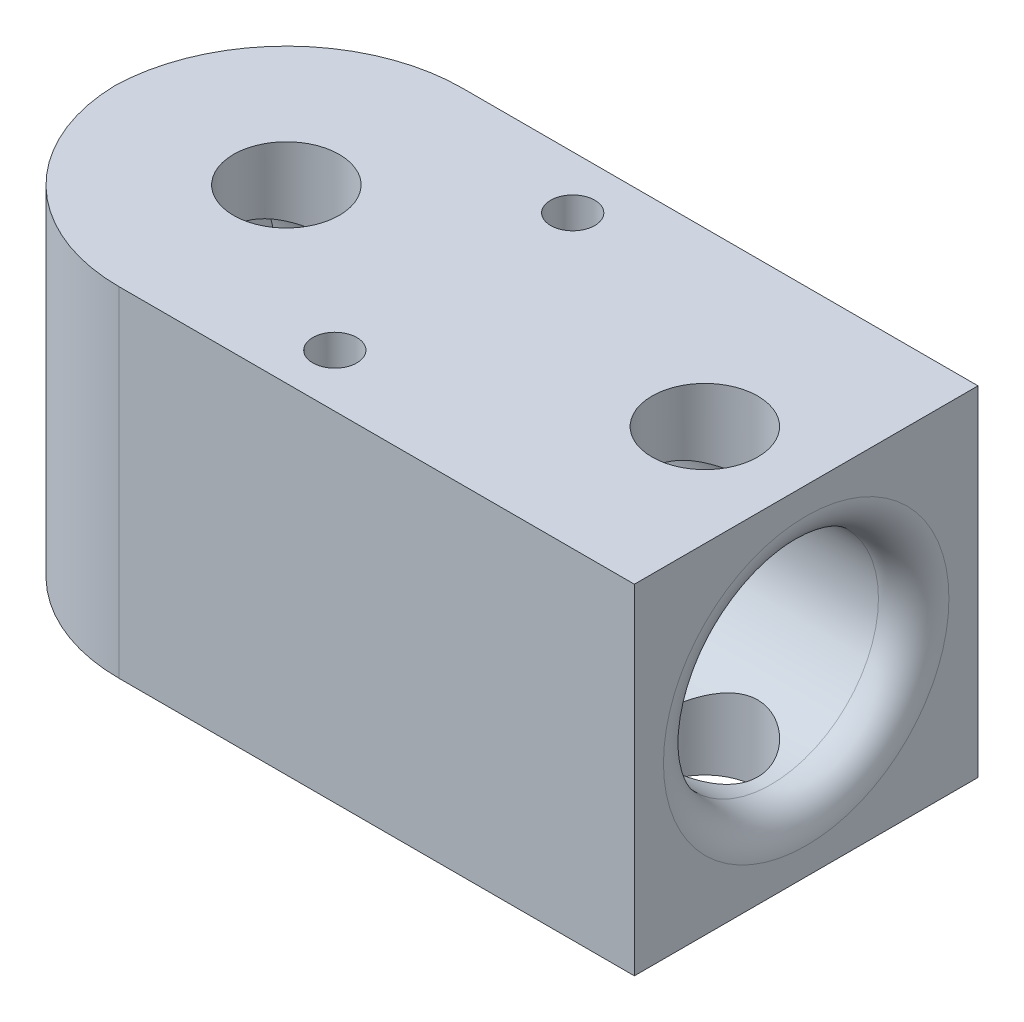
from build123d import *

# Parameters (mm, degrees)
SKETCH1_W           = 39.25
SKETCH1_H           = 19.5
SKETCH1_R           = 1.25
SKETCH1_R_2         = 3
BOSS_EXTRUDE1_DEPTH = 19.25
CUT_EXTRUDE1_DEPTH  = 36.25
FILLET1_R           = 2
FILLET3_R           = 10
CUT_EXTRUDE3_REACH  = 47.441
SKETCH4_R           = 5


with BuildPart() as part:
    # Sketch1 → Boss-Extrude1 (new body)
    with BuildSketch(Plane(origin=(0, 0, 0), x_dir=(1, 0, 0), z_dir=(0, 1, 0))):
        with Locations((19.625, -9.75)):
            Rectangle(SKETCH1_W, SKETCH1_H)
        with Locations(Location((19.25, -16.5, 0), (0, 0, 270))):
            Circle(SKETCH1_R, mode=Mode.SUBTRACT)
        with Locations(Location((19.25, -3, 0), (0, 0, 270))):
            Circle(SKETCH1_R, mode=Mode.SUBTRACT)
        with Locations(Location((9.75, -9.75, 0), (0, 0, 270))):
            Circle(SKETCH1_R_2, mode=Mode.SUBTRACT)
        with Locations(Location((33.5, -9.75, 0), (0, 0, 270))):
            Circle(SKETCH1_R_2, mode=Mode.SUBTRACT)
    extrude(amount=BOSS_EXTRUDE1_DEPTH)

    # Sketch2 → Cut-Extrude1 (cut)
    with BuildSketch(Plane(origin=(39.25, 0, 0), x_dir=(0, 0, -1), z_dir=(1, 0, 0))):
        with BuildLine():
            ThreePointArc((-3.65, 9.625), (-7.433822489, 15.268165932), (-14.091089094, 13.910434106))
            Line((-14.091089094, 13.910434106), (-5.408910906, 5.339565894))
            ThreePointArc((-5.408910906, 5.339565894), (-4.106834068, 7.308822489), (-3.65, 9.625))
        make_face()
        with BuildLine():
            Line((-5.408910906, 5.339565894), (-14.091089094, 13.910434106))
            ThreePointArc((-14.091089094, 13.910434106), (-14.035434106, 5.283910906), (-5.408910906, 5.339565894))
        make_face()
    extrude(amount=-CUT_EXTRUDE1_DEPTH, mode=Mode.SUBTRACT)

    # Fillet1
    fillet1_edges = [part.edges().sort_by_distance(p)[0] for p in [
        (39.25, 5.339565894, 5.408910906),
    ]]
    fillet(fillet1_edges, radius=FILLET1_R)

    # Fillet3
    # the kernel refuses this fillet: 10 mm, written as the material it takes off along each edge
    with BuildSketch(Plane(origin=(0, -25, 19.5), x_dir=(1, 0, 0), z_dir=(0, 1, 0))) as fillet3_piece_1:
        with BuildLine():
            CenterArc((FILLET3_R, FILLET3_R), FILLET3_R, 180, 90)
            Line((0, FILLET3_R), (0, 0))
            Line((0, 0), (FILLET3_R, 0))
        make_face()
    extrude(amount=69.25, mode=Mode.SUBTRACT)
    with BuildSketch(Plane(origin=(0, -25, 0), x_dir=(1, 0, 0), z_dir=(0, 1, 0))) as fillet3_piece_2:
        with BuildLine():
            CenterArc((FILLET3_R, -FILLET3_R), FILLET3_R, 90, 90)
            Line((0, -FILLET3_R), (0, 0))
            Line((0, 0), (FILLET3_R, 0))
        make_face()
    extrude(amount=69.25, mode=Mode.SUBTRACT)

    # Sketch4 → Cut-Extrude3 (cut, up to next)
    with BuildSketch(Plane(origin=(3, 0, 0), x_dir=(0, 0, -1), z_dir=(1, 0, 0)), mode=Mode.PRIVATE) as cut_extrude3_sk1:
        with Locations((-9.75, 9.625)):
            Circle(SKETCH4_R)
    cut_extrude3_tool1 = extrude(cut_extrude3_sk1.sketch, amount=-CUT_EXTRUDE3_REACH, mode=Mode.PRIVATE) & part.part
    add(cut_extrude3_tool1.solids().sort_by_distance((3, 9.625, 9.75))[0], mode=Mode.SUBTRACT)


solid = part.part
